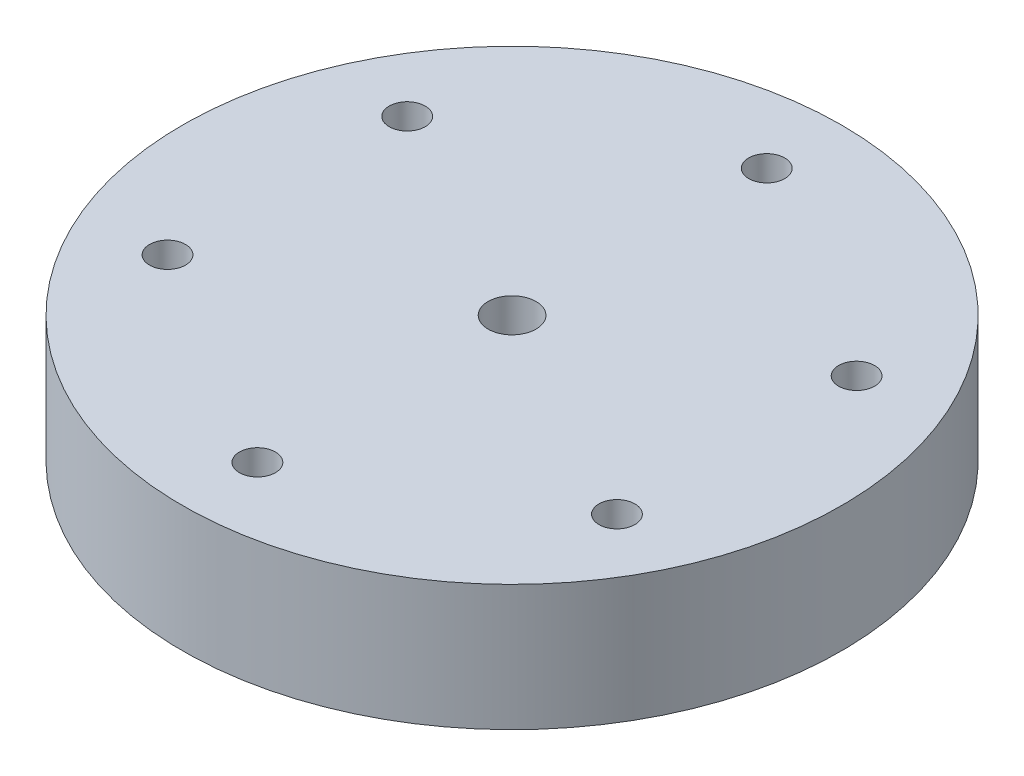
from build123d import *

# Parameters (mm, degrees)
SKETCH1_R               = 55
SKETCH1_R_2             = 4
BOSS_EXTRUDE1_DEPTH     = 21
CUT_EXTRUDE3_DEPTH      = 81.566742518
CUT_EXTRUDE3_DEPTH_BACK = 10
SKETCH2_R               = 3
SKETCH3_R               = 5
CUT_EXTRUDE4_DEPTH      = 5


with BuildPart() as part:
    # Sketch1 → Boss-Extrude1 (new body)
    with BuildSketch(Plane(origin=(0, 0, 0), x_dir=(1, 0, 0), z_dir=(0, 1, 0))):
        Circle(SKETCH1_R)
        Circle(SKETCH1_R_2, mode=Mode.SUBTRACT)
    extrude(amount=BOSS_EXTRUDE1_DEPTH)

    # Sketch2 → Cut-Extrude3 (cut, two sides: drawn at the far end of the back side and taken through both)
    with BuildSketch(Plane(origin=(0, 0, 0), x_dir=(1, 0, 0), z_dir=(0, 1, 0)).offset(-CUT_EXTRUDE3_DEPTH_BACK)):
        with Locations((-37.5, 20)):
            Circle(SKETCH2_R)
        with Locations((-37.5, -20)):
            Circle(SKETCH2_R)
        with Locations((37.5, -20)):
            Circle(SKETCH2_R)
        with Locations((37.5, 20)):
            Circle(SKETCH2_R)
        with Locations((0, 42.5)):
            Circle(SKETCH2_R)
        with Locations((0, -42.5)):
            Circle(SKETCH2_R)
    extrude(amount=CUT_EXTRUDE3_DEPTH + CUT_EXTRUDE3_DEPTH_BACK, mode=Mode.SUBTRACT)

    # Sketch3 → Cut-Extrude4 (cut)
    with BuildSketch(Plane(origin=(0, 0, 0), x_dir=(1, 0, 0), z_dir=(0, 1, 0))):
        with Locations((-37.5, 20)):
            Circle(SKETCH3_R)
        with Locations((-37.5, -20)):
            Circle(SKETCH3_R)
        with Locations((37.5, 20)):
            Circle(SKETCH3_R)
        with Locations((37.5, -20)):
            Circle(SKETCH3_R)
        with Locations((0, 42.5)):
            Circle(SKETCH3_R)
        with Locations((0, -42.5)):
            Circle(SKETCH3_R)
    extrude(amount=CUT_EXTRUDE4_DEPTH, mode=Mode.SUBTRACT)


solid = part.part
